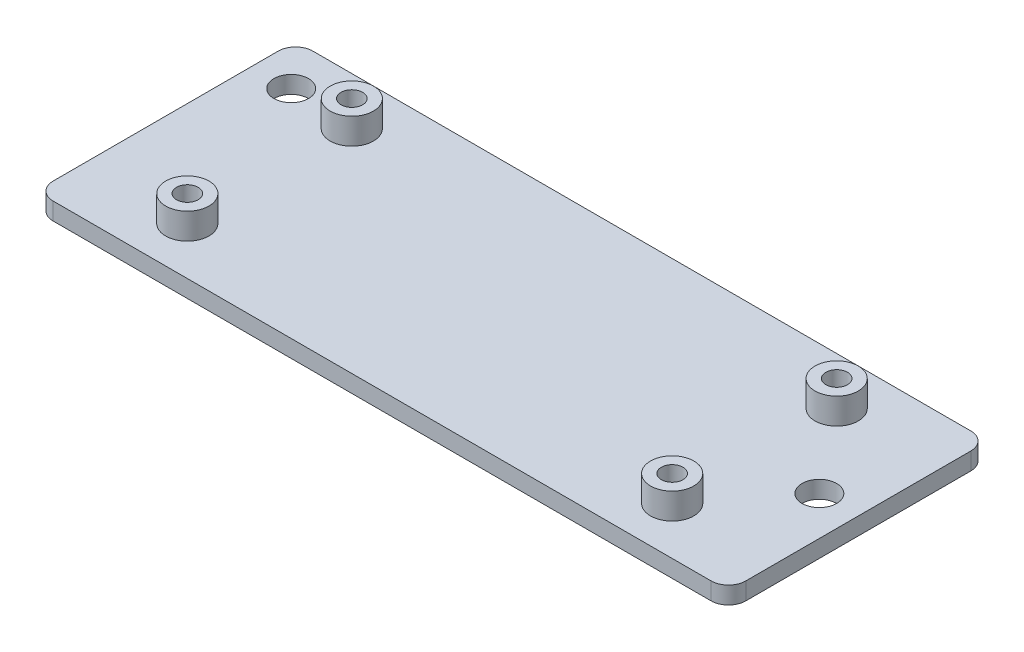
from build123d import *

# Parameters (mm, degrees)
SKETCH_1_W               = 80
SKETCH_1_H               = 30
EXTRUDE_1_DEPTH          = 2
SKETCH_2_R               = 2.5
EXTRUDE_2_DEPTH          = 3
CUT_EXTRUDE_1_DEPTH      = 86.586213843
CUT_EXTRUDE_1_DEPTH_BACK = 86.586213843
SKETCH_3_R               = 1.25
CUT_EXTRUDE_2_DEPTH      = 86.492689746
CUT_EXTRUDE_2_DEPTH_BACK = 86.492689746
SKETCH_4_R               = 2
FILLET_1_R               = 2
FILLET_2_R               = 2
FILLET_3_R               = 2
FILLET_4_R               = 2


with BuildPart() as part:
    # Эскиз1 → Бобышка-Вытянуть1 (new body)
    with BuildSketch(Plane(origin=(0, 0, 0), x_dir=(1, 0, 0), z_dir=(0, 1, 0))):
        with Locations((40, -15)):
            Rectangle(SKETCH_1_W, SKETCH_1_H)
    extrude(amount=EXTRUDE_1_DEPTH)

    # Эскиз2 → Бобышка-Вытянуть2 (add)
    with BuildSketch(Plane(origin=(0, 2, 0), x_dir=(1, 0, 0), z_dir=(0, 1, 0))):
        with Locations((12, -5.5)):
            Circle(SKETCH_2_R)
        with Locations((12, -24.5)):
            Circle(SKETCH_2_R)
        with Locations((68, -5.5)):
            Circle(SKETCH_2_R)
        with Locations((68, -24.5)):
            Circle(SKETCH_2_R)
    extrude(amount=EXTRUDE_2_DEPTH)

    # Эскиз3 → Вырез-Вытянуть1 (cut, two sides: drawn at the far end of the back side and taken through both)
    with BuildSketch(Plane(origin=(0, 5, 0), x_dir=(1, 0, 0), z_dir=(0, 1, 0)).offset(-CUT_EXTRUDE_1_DEPTH_BACK)):
        with Locations((12, -5.5)):
            Circle(SKETCH_3_R)
        with Locations((12, -24.5)):
            Circle(SKETCH_3_R)
        with Locations((68, -5.5)):
            Circle(SKETCH_3_R)
        with Locations((68, -24.5)):
            Circle(SKETCH_3_R)
    extrude(amount=CUT_EXTRUDE_1_DEPTH + CUT_EXTRUDE_1_DEPTH_BACK, mode=Mode.SUBTRACT)

    # Эскиз4 → Вырез-Вытянуть2 (cut, two sides: drawn at the far end of the back side and taken through both)
    with BuildSketch(Plane(origin=(0, 2, 0), x_dir=(1, 0, 0), z_dir=(0, 1, 0)).offset(-CUT_EXTRUDE_2_DEPTH_BACK)):
        with Locations((4.5, -5)):
            Circle(SKETCH_4_R)
        with Locations((75.5, -15)):
            Circle(SKETCH_4_R)
    extrude(amount=CUT_EXTRUDE_2_DEPTH + CUT_EXTRUDE_2_DEPTH_BACK, mode=Mode.SUBTRACT)

    # Скругление1
    fillet_1_edges = [part.edges().sort_by_distance(p)[0] for p in [
        (0, 1, 30),
    ]]
    fillet(fillet_1_edges, radius=FILLET_1_R)

    # Скругление2
    fillet_2_edges = [part.edges().sort_by_distance(p)[0] for p in [
        (0, 1, 0),
    ]]
    fillet(fillet_2_edges, radius=FILLET_2_R)

    # Скругление3
    fillet_3_edges = [part.edges().sort_by_distance(p)[0] for p in [
        (80, 1, 0),
    ]]
    fillet(fillet_3_edges, radius=FILLET_3_R)

    # Скругление4
    fillet_4_edges = [part.edges().sort_by_distance(p)[0] for p in [
        (80, 1, 30),
    ]]
    fillet(fillet_4_edges, radius=FILLET_4_R)


solid = part.part
